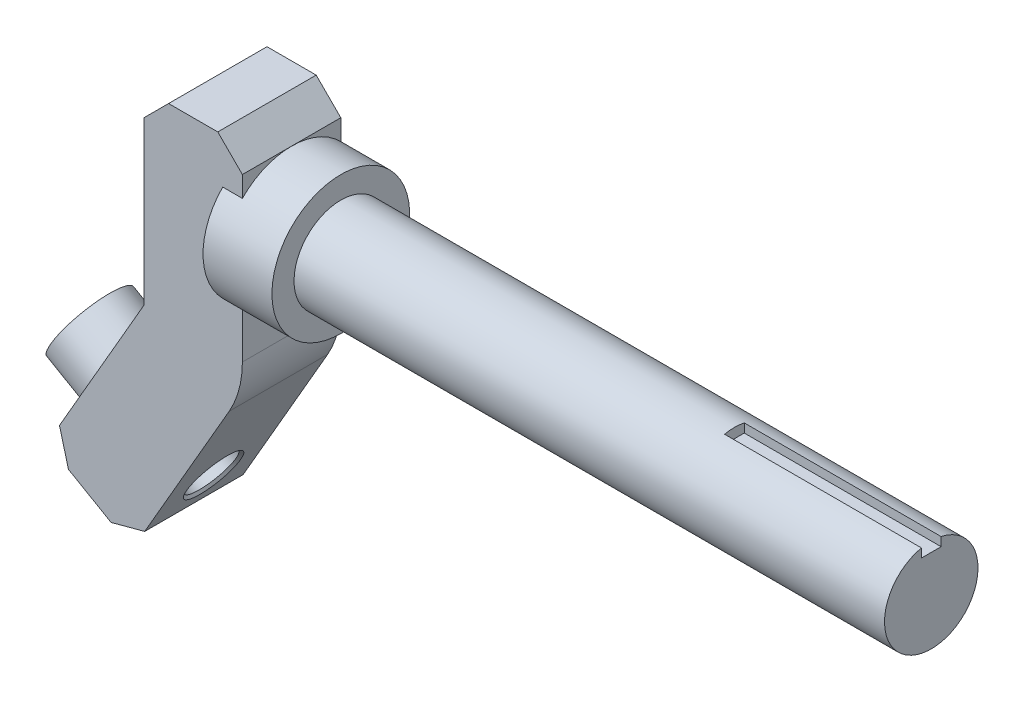
from build123d import *

# Parameters (mm, degrees)
SCHIZZO1_R                   = 9.5
ESTRUSIONE_ESTRUSIONE1_DEPTH = 120
TAGLIO_ESTRUSIONE1_START     = -40
TAGLIO_ESTRUSIONE1_DEPTH     = 40
SCHIZZO3_R                   = 14
ESTRUSIONE_ESTRUSIONE2_DEPTH = 14
ESTRUSIONE_ESTRUSIONE3_DEPTH = 10
SMUSSO1_SIZE                 = 5
SMUSSO2_SIZE                 = 2
SMUSSO3_SIZE                 = 5
SMUSSO4_SIZE                 = 0.5
ESTRUSIONE_ESTRUSIONE4_START = 9
SCHIZZO7_R                   = 8
SCHIZZO7_R_2                 = 5
ESTRUSIONE_ESTRUSIONE4_DEPTH = 9
SMUSSO5_SIZE                 = 0.5


# Some blends are built 0.0001 mm under size
with BuildPart() as part:
    # Schizzo1 → Estrusione-Estrusione1 (new body)
    with BuildSketch(Plane(origin=(0, 0, 0), x_dir=(0, 0, -1), z_dir=(1, 0, 0))):
        Circle(SCHIZZO1_R)
    extrude(amount=ESTRUSIONE_ESTRUSIONE1_DEPTH)

    # Schizzo2 → Taglio-Estrusione1 (cut)
    with BuildSketch(Plane(origin=(120, 0, 0), x_dir=(0, 0, -1), z_dir=(1, 0, 0)).offset(TAGLIO_ESTRUSIONE1_START)):
        with BuildLine():
            Line((-2, 9.287087811), (-2, 7.5))
            Line((-2, 7.5), (2, 7.5))
            Line((2, 7.5), (2, 9.287087811))
            ThreePointArc((2, 9.287087811), (0, 9.5), (-2, 9.287087811))
        make_face()
    extrude(amount=TAGLIO_ESTRUSIONE1_DEPTH, mode=Mode.SUBTRACT)

    # Schizzo3 → Estrusione-Estrusione2 (add)
    with BuildSketch(Plane.ZY):
        Circle(SCHIZZO3_R)
    extrude(amount=ESTRUSIONE_ESTRUSIONE2_DEPTH)

    # Schizzo4 → Estrusione-Estrusione3 (add, symmetric)
    with BuildSketch(Plane.XY):
        with BuildLine():
            Line((-10, 19), (-10, 9.5))
            Line((-10, 9.5), (-15, 9.5))
            Line((-15, 9.5), (-15, -9.5))
            Line((-15, -9.5), (-10, -9.5))
            Line((-10, -9.5), (-10, -19))
            ThreePointArc((-10, -19), (-10.681483474, -24.176380902), (-12.679491924, -29))
            Line((-12.679491924, -29), (-32.352250588, -63.074217531))
            Line((-32.352250588, -63.074217531), (-49.672758664, -53.074217531))
            Line((-49.672758664, -53.074217531), (-30, -19))
            Line((-30, -19), (-30, 19))
            Line((-30, 19), (-10, 19))
        make_face()
    extrude(amount=ESTRUSIONE_ESTRUSIONE3_DEPTH, both=True)

    # Smusso1
    smusso1_edges = [part.edges().sort_by_distance(p)[0] for p in [
        (-10, 19, 0),
        (-30, 19, 0),
    ]]
    chamfer(smusso1_edges, length=SMUSSO1_SIZE - 0.0001)  # a hair under: the kernel refuses the full size

    # Smusso2
    # the kernel refuses this chamfer: 2 mm, written as the material it adds along each edge
    with BuildSketch(Plane(origin=(-15, 9.5, 10), x_dir=(0.9996219169112968, 0.027495876610586487, 0), z_dir=(0, 0, -1)), Plane(origin=(-15, -9.5, 10), x_dir=(-0.02749587661058651, 0.9996219169112968, 0), z_dir=(0, 0, -1))) as smusso2_piece_1:
        Polygon((SMUSSO2_SIZE * 0.999621916911, SMUSSO2_SIZE * 0.0274958766106), (-SMUSSO2_SIZE * 0.0274958766106, SMUSSO2_SIZE * 0.999621916911), (0, 0), align=None)
    extrude(amount=20)

    # Smusso3
    smusso3_edges = [part.edges().sort_by_distance(p)[0] for p in [
        (-49.672758664, -53.074217531, 0),
        (-32.352250588, -63.074217531, 0),
    ]]
    chamfer(smusso3_edges, length=SMUSSO3_SIZE)

    # Schizzo6 → Taglia-Rivoluzione1 (revolve, cut)
    with BuildSketch(Plane.XY, mode=Mode.PRIVATE) as taglia_rivoluzione1_sk:
        Polygon((-43.172758664, -41.815887282), (-25.852250588, -51.815887282), (-23.352250588, -47.485760263), (-40.672758664, -37.485760263), align=None)
    revolve(taglia_rivoluzione1_sk.sketch.rotate(Axis((-115.6, 0, 0), (0.8660254037844387, -0.5000000000000001, 0)), 180), axis=Axis((-115.6, 0, 0), (0.8660254037844387, -0.5000000000000001, 0)), mode=Mode.SUBTRACT)

    # Smusso4
    smusso4_edges = [part.edges().sort_by_distance(p)[0] for p in [
        (-23.352250588, -47.485760263, 0),
    ]]
    chamfer(smusso4_edges, length=SMUSSO4_SIZE)

    # Schizzo7 → Estrusione-Estrusione4 (add)
    with BuildSketch(Plane(origin=(-14.272758664, 8.240381057, 0), x_dir=(0, 0, 1), z_dir=(-0.8660254037844383, 0.5000000000000009, 0)).offset(ESTRUSIONE_ESTRUSIONE4_START)):
        with Locations(Location((0, -57.8, 0), (0, 0, 270))):
            Circle(SCHIZZO7_R)
        with Locations(Location((0, -57.8, 0), (0, 0, 270))):
            Circle(SCHIZZO7_R_2, mode=Mode.SUBTRACT)
    extrude(amount=-ESTRUSIONE_ESTRUSIONE4_DEPTH)

    # Smusso5
    smusso5_edges = [part.edges().sort_by_distance(p)[0] for p in [
        (-48.466987298, -32.985760263, 0),
    ]]
    chamfer(smusso5_edges, length=SMUSSO5_SIZE)


solid = part.part
